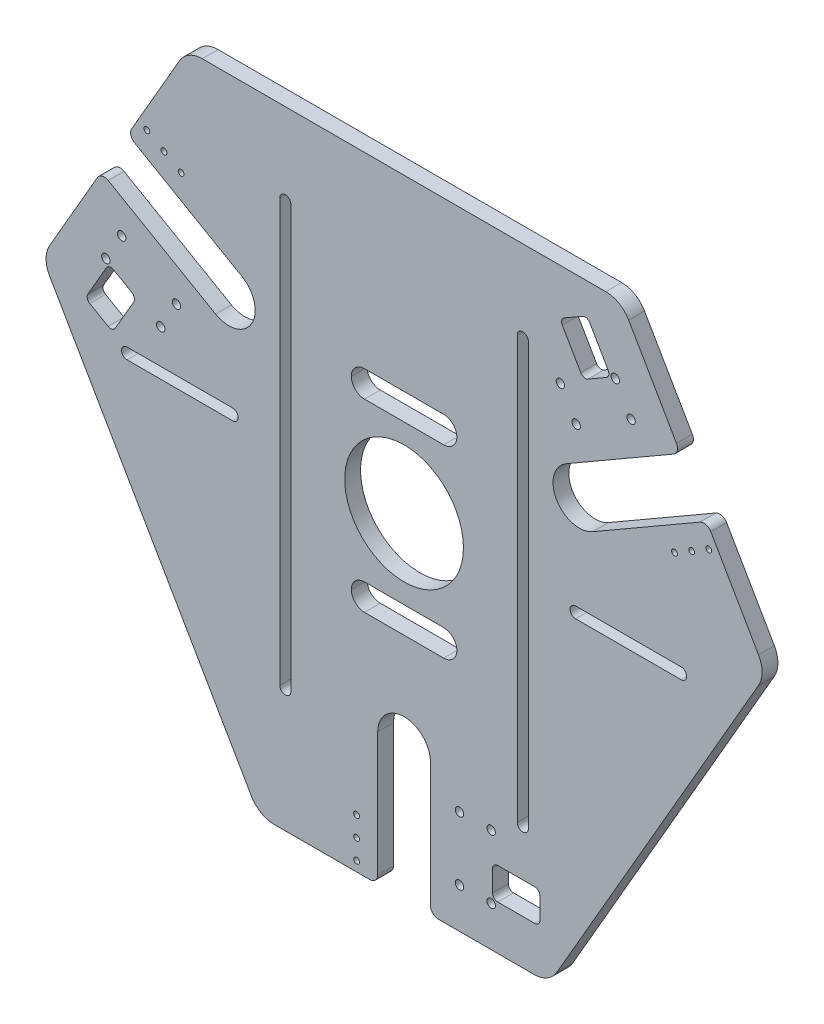
from build123d import *

# Parameters (mm, degrees)
BOSS_EXTRUDE1_DEPTH = 6
CUT_EXTRUDE2_DEPTH  = 6
SKETCH4_R           = 1.6
SKETCH4_W           = 18
SKETCH4_H           = 12
CUT_EXTRUDE3_DEPTH  = 10
FILLET1_R           = 2
FILLET2_R           = 2
SKETCH5_R           = 1.1
CUT_EXTRUDE4_DEPTH  = 10
SKETCH6_R           = 22.5
CUT_EXTRUDE5_DEPTH  = 10
FILLET4_R           = 10
FILLET5_R           = 10
FILLET6_R           = 10
FILLET7_R           = 10
FILLET8_R           = 3
SKETCH8_W           = 40
SKETCH8_H           = 10
CUT_EXTRUDE11_DEPTH = 10
FILLET9_R           = 5
CUT_EXTRUDE13_DEPTH = 10
FILLET10_R          = 2


with BuildPart() as part:
    # Sketch1 → Boss-Extrude1 (new body)
    with BuildSketch(Plane.XY):
        Polygon((0, -126.72), (0, 0), (-109.742739168, 63.36), (-137.242739168, 15.728602792), (-55, -126.72), align=None)
        Polygon((-109.742739168, 63.36), (0, 0), (100, 57.735026919), (109.742739168, 63.36), (82.242739168, 110.991397208), (-82.242739168, 110.991397208), align=None)
        Polygon((100, 57.735026919), (0, 0), (0, -126.72), (55, -126.72), (137.242739168, 15.728602792), (109.742739168, 63.36), align=None)
    extrude(amount=BOSS_EXTRUDE1_DEPTH)

    # Sketch3 → Cut-Extrude2 (cut)
    with BuildSketch(Plane.XY.offset(6)):
        Polygon((-109.742739168, 63.36), (-114.742739168, 54.699745962), (-62.78121494, 24.699745962), (-57.78121494, 33.36), align=None)
        Polygon((-104.742739168, 72.020254038), (-109.742739168, 63.36), (-57.78121494, 33.36), (-52.78121494, 42.020254038), align=None)
        Polygon((104.742739168, 72.020254038), (52.78121494, 42.020254038), (57.78121494, 33.36), (62.78121494, 24.699745962), (114.742739168, 54.699745962), align=None)
        Polygon((10, -126.72), (10, -66.72), (0, -66.72), (-10, -66.72), (-10, -126.72), align=None)
    extrude(amount=-CUT_EXTRUDE2_DEPTH, mode=Mode.SUBTRACT)

    # Sketch4 → Cut-Extrude3 (cut)
    with BuildSketch(Plane.XY.offset(6)):
        with Locations((21, -87.47)):
            Circle(SKETCH4_R)
        with Locations((33, -87.47)):
            Circle(SKETCH4_R)
        with Locations((21, -111.47)):
            Circle(SKETCH4_R)
        with Locations((33, -111.47)):
            Circle(SKETCH4_R)
        with Locations((-86.251242069, 25.548466521)):
            Circle(SKETCH4_R)
        with Locations((-92.251242069, 15.156161675)):
            Circle(SKETCH4_R)
        with Locations((-113.03585176, 27.156161675)):
            Circle(SKETCH4_R)
        with Locations((-107.03585176, 37.548466521)):
            Circle(SKETCH4_R)
        with Locations((65.251242069, 61.921533479)):
            Circle(SKETCH4_R)
        with Locations((59.251242069, 72.313838325)):
            Circle(SKETCH4_R)
        with Locations((80.03585176, 84.313838325)):
            Circle(SKETCH4_R)
        with Locations((86.03585176, 73.921533479)):
            Circle(SKETCH4_R)
        Polygon((-111.856909844, 25.898148973), (-101.464604998, 19.898148973), (-110.464604998, 4.309691705), (-120.856909844, 10.309691705), align=None)
        Polygon((69.356909844, 99.510308295), (58.964604998, 93.510308295), (67.964604998, 77.921851027), (78.356909844, 83.921851027), align=None)
        with Locations((42.5, -103.82)):
            Rectangle(SKETCH4_W, SKETCH4_H)
    extrude(amount=-CUT_EXTRUDE3_DEPTH, mode=Mode.SUBTRACT)

    # Fillet1
    fillet1_edges = [part.edges().sort_by_distance(p)[0] for p in [
        (33.5, -109.82, 3),
        (33.5, -97.82, 3),
        (51.5, -97.82, 3),
        (51.5, -109.82, 3),
    ]]
    fillet(fillet1_edges, radius=FILLET1_R)

    # Fillet2
    fillet2_edges = [part.edges().sort_by_distance(p)[0] for p in [
        (-120.856909844, 10.309691705, 3),
        (-111.856909844, 25.898148973, 3),
        (-101.464604998, 19.898148973, 3),
        (-110.464604998, 4.309691705, 3),
    ]]
    fillet(fillet2_edges, radius=FILLET2_R)

    # Sketch5 → Cut-Extrude4 (cut)
    with BuildSketch(Plane.XY.offset(6)):
        with Locations((115.495143903, 45.896542732)):
            Circle(SKETCH5_R)
        with Locations((108.999953375, 42.146542732)):
            Circle(SKETCH5_R)
        with Locations((102.504762847, 38.396542732)):
            Circle(SKETCH5_R)
        with Locations((-18, -122.97)):
            Circle(SKETCH5_R)
        with Locations((-18, -115.47)):
            Circle(SKETCH5_R)
        with Locations((-18, -107.97)):
            Circle(SKETCH5_R)
        with Locations((-97.495143903, 77.073457268)):
            Circle(SKETCH5_R)
        with Locations((-90.999953375, 73.323457268)):
            Circle(SKETCH5_R)
        with Locations((-84.504762847, 69.573457268)):
            Circle(SKETCH5_R)
    extrude(amount=-CUT_EXTRUDE4_DEPTH, mode=Mode.SUBTRACT)

    # Sketch6 → Cut-Extrude5 (cut)
    with BuildSketch(Plane.XY.offset(6)):
        Circle(SKETCH6_R)
    extrude(amount=-CUT_EXTRUDE5_DEPTH, mode=Mode.SUBTRACT)

    # Fillet4
    fillet4_edges = [part.edges().sort_by_distance(p)[0] for p in [
        (-10, -66.72, 3),
        (10, -66.72, 3),
    ]]
    fillet(fillet4_edges, radius=FILLET4_R - 0.0001)  # a hair under: the kernel refuses the full size

    # Fillet5
    fillet5_edges = [part.edges().sort_by_distance(p)[0] for p in [
        (62.78121494, 24.699745962, 3),
        (52.78121494, 42.020254038, 3),
    ]]
    fillet(fillet5_edges, radius=FILLET5_R - 0.0001)  # a hair under: the kernel refuses the full size

    # Fillet6
    fillet6_edges = [part.edges().sort_by_distance(p)[0] for p in [
        (-52.78121494, 42.020254038, 3),
        (-62.78121494, 24.699745962, 3),
    ]]
    fillet(fillet6_edges, radius=FILLET6_R - 0.0001)  # a hair under: the kernel refuses the full size

    # Fillet7
    fillet7_edges = [part.edges().sort_by_distance(p)[0] for p in [
        (55, -126.72, 3),
        (-55, -126.72, 3),
        (-137.242739168, 15.728602792, 3),
        (-82.242739168, 110.991397208, 3),
        (82.242739168, 110.991397208, 3),
        (137.242739168, 15.728602792, 3),
    ]]
    fillet(fillet7_edges, radius=FILLET7_R)

    # Fillet8
    fillet8_edges = [part.edges().sort_by_distance(p)[0] for p in [
        (-114.742739168, 54.699745962, 3),
        (-104.742739168, 72.020254038, 3),
        (104.742739168, 72.020254038, 3),
        (114.742739168, 54.699745962, 3),
        (10, -126.72, 3),
        (-10, -126.72, 3),
    ]]
    fillet(fillet8_edges, radius=FILLET8_R)

    # Sketch8 → Cut-Extrude11 (cut)
    with BuildSketch(Plane.XY.offset(6)):
        with Locations((0, 35)):
            Rectangle(SKETCH8_W, SKETCH8_H)
        with Locations((0, -35)):
            Rectangle(SKETCH8_W, SKETCH8_H)
    extrude(amount=-CUT_EXTRUDE11_DEPTH, mode=Mode.SUBTRACT)

    # Fillet9
    fillet9_edges = [part.edges().sort_by_distance(p)[0] for p in [
        (20, -40, 3),
        (20, -30, 3),
        (-20, -40, 3),
        (-20, -30, 3),
        (20, 30, 3),
        (20, 40, 3),
        (-20, 30, 3),
        (-20, 40, 3),
    ]]
    fillet(fillet9_edges, radius=FILLET9_R - 0.0001)  # a hair under: the kernel refuses the full size

    # Sketch7 → Cut-Extrude13 (cut)
    with BuildSketch(Plane.XY.offset(6)):
        with BuildLine():
            Line((-47.1, 80), (-47.1, -80))
            ThreePointArc((-47.1, -80), (-45, -82.1), (-42.9, -80))
            Line((-42.9, -80), (-42.9, 80))
            ThreePointArc((-42.9, 80), (-45, 82.1), (-47.1, 80))
        make_face()
        with BuildLine():
            Line((42.9, 80), (42.9, -80))
            ThreePointArc((42.9, -80), (45, -82.1), (47.1, -80))
            Line((47.1, -80), (47.1, 80))
            ThreePointArc((47.1, 80), (45, 82.1), (42.9, 80))
        make_face()
        with BuildLine():
            Line((-105, 2.1), (-65, 2.1))
            ThreePointArc((-65, 2.1), (-62.9, 0), (-65, -2.1))
            Line((-65, -2.1), (-105, -2.1))
            ThreePointArc((-105, -2.1), (-107.1, 0), (-105, 2.1))
        make_face()
        with BuildLine():
            Line((65, 2.1), (105, 2.1))
            ThreePointArc((105, 2.1), (107.1, 0), (105, -2.1))
            Line((105, -2.1), (65, -2.1))
            ThreePointArc((65, -2.1), (62.9, 0), (65, 2.1))
        make_face()
    extrude(amount=-CUT_EXTRUDE13_DEPTH, mode=Mode.SUBTRACT)

    # Fillet10
    fillet10_edges = [part.edges().sort_by_distance(p)[0] for p in [
        (69.356909844, 99.510308295, 3),
        (78.356909844, 83.921851027, 3),
        (67.964604998, 77.921851027, 3),
        (58.964604998, 93.510308295, 3),
    ]]
    fillet(fillet10_edges, radius=FILLET10_R)


solid = part.part
